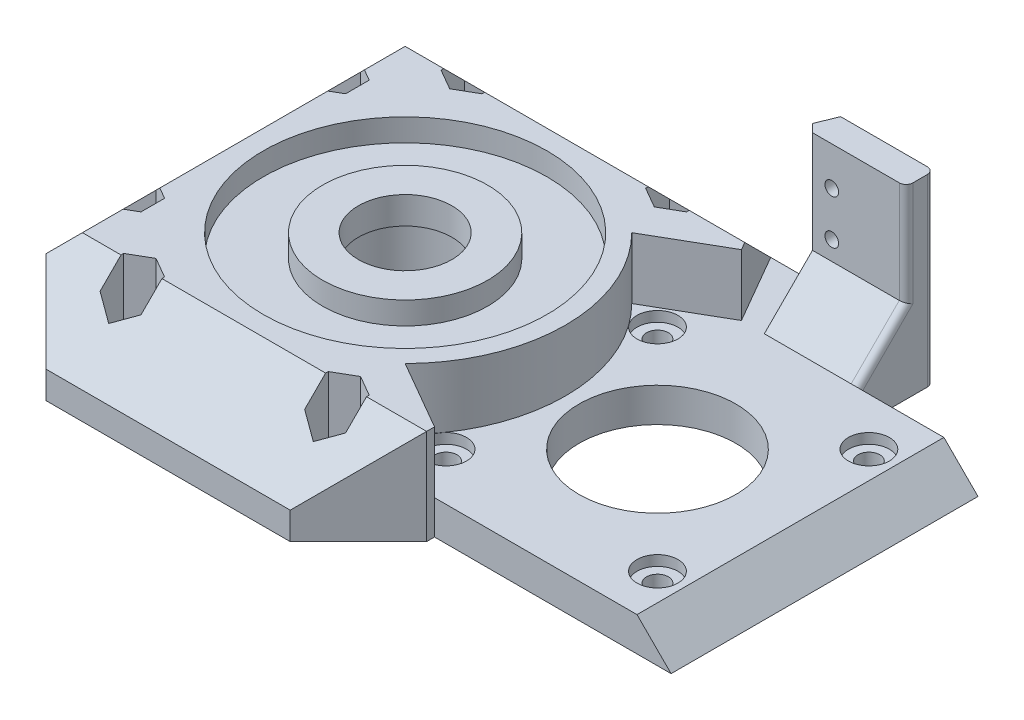
from build123d import *

# Parameters (mm, degrees)
SKETCH1_R                = 11.5
SKETCH1_R_2              = 1.6
BOSS_EXTRUDE1_DEPTH      = 5
BOSS_EXTRUDE2_DEPTH      = 9
SKETCH3_R                = 20.8
SKETCH3_R_2              = 12.1
CUT_EXTRUDE1_DEPTH       = 3.3
SKETCH4_R                = 6.85
CUT_EXTRUDE2_DEPTH       = 4
SKETCH5_R                = 7.85
CUT_EXTRUDE3_DEPTH       = 10
CUT_EXTRUDE4_DEPTH       = 10
SKETCH7_R                = 2.15
CUT_EXTRUDE5_DEPTH       = 79.90393653
CHAMFER1_SIZE            = 10
CHAMFER2_SIZE            = 14.66
CHAMFER3_SIZE            = 5
SKETCH8_R                = 3
CUT_EXTRUDE6_DEPTH       = 1.5
BOSS_EXTRUDE3_DEPTH      = 22
BOSS_EXTRUDE3_DEPTH_BACK = 1.5
BOSS_EXTRUDE4_DEPTH      = 13.73
SKETCH12_R               = 1
CUT_EXTRUDE7_DEPTH       = 13.73
SKETCH13_R               = 2.5
CUT_EXTRUDE8_DEPTH       = 1.5
FILLET1_R                = 1


# Some blends are built 0.0001 mm under size
with BuildPart() as part:
    # Sketch1 → Boss-Extrude1 (new body)
    with BuildSketch(Plane(origin=(0, 0, 0), x_dir=(1, 0, 0), z_dir=(0, 1, 0))):
        Polygon((24.5, 22.5), (24.5, -22.5), (-10.19, -22.5), (-10.19, -33.66), (-70.66, -33.66), (-70.66, 33.66), (6.9, 33.66), (6.9, 22.5), align=None)
        with Locations(Location((0, 0, 0), (0, 0, 270))):
            Circle(SKETCH1_R, mode=Mode.SUBTRACT)
        with Locations(Location((15.5, 15.5, 0), (0, 0, 270))):
            Circle(SKETCH1_R_2, mode=Mode.SUBTRACT)
        with Locations(Location((15.5, -15.5, 0), (0, 0, 270))):
            Circle(SKETCH1_R_2, mode=Mode.SUBTRACT)
        with Locations(Location((-15.5, -15.5, 0), (0, 0, 270))):
            Circle(SKETCH1_R_2, mode=Mode.SUBTRACT)
        with Locations(Location((-15.5, 15.5, 0), (0, 0, 270))):
            Circle(SKETCH1_R_2, mode=Mode.SUBTRACT)
    extrude(amount=BOSS_EXTRUDE1_DEPTH)

    # Sketch2 → Boss-Extrude2 (add)
    with BuildSketch(Plane(origin=(0, 5, 0), x_dir=(1, 0, 0), z_dir=(0, 1, 0))):
        with BuildLine():
            Line((-10.19, -33.66), (-10.19, -22.5))
            Line((-10.19, -22.5), (-20.381763801, -16.615782426))
            ThreePointArc((-20.381763801, -16.615782426), (-45.992259152, -21.711500992), (-60.5, 0))
            Line((-60.5, 0), (-70.66, 0))
            Line((-70.66, 0), (-70.66, -33.66))
            Line((-70.66, -33.66), (-10.19, -33.66))
        make_face()
        with BuildLine():
            ThreePointArc((-60.5, 0), (-45.992259152, -21.711500992), (-20.381763801, -16.615782426))
            ThreePointArc((-20.381763801, -16.615782426), (-15.288499008, -8.992259152), (-13.5, 0))
            Line((-13.5, 0), (-60.5, 0))
        make_face()
        with BuildLine():
            Line((-60.5, 0), (-13.5, 0))
            ThreePointArc((-13.5, 0), (-15.288499008, 8.992259152), (-20.381763801, 16.615782426))
            ThreePointArc((-20.381763801, 16.615782426), (-45.992259152, 21.711500992), (-60.5, 0))
        make_face()
        with BuildLine():
            Line((-70.66, 0), (-60.5, 0))
            ThreePointArc((-60.5, 0), (-45.992259152, 21.711500992), (-20.381763801, 16.615782426))
            Line((-20.381763801, 16.615782426), (-10.19, 22.5))
            Line((-10.19, 22.5), (-16.633229004, 33.66))
            Line((-16.633229004, 33.66), (-70.66, 33.66))
            Line((-70.66, 33.66), (-70.66, 0))
        make_face()
    extrude(amount=BOSS_EXTRUDE2_DEPTH)

    # Sketch3 → Cut-Extrude1 (cut)
    with BuildSketch(Plane(origin=(0, 14, 0), x_dir=(1, 0, 0), z_dir=(0, 1, 0))):
        with Locations(Location((-37, 0, 0), (0, 0, 270))):
            Circle(SKETCH3_R)
        with Locations(Location((-37, 0, 0), (0, 0, 270))):
            Circle(SKETCH3_R_2, mode=Mode.SUBTRACT)
    extrude(amount=-CUT_EXTRUDE1_DEPTH, mode=Mode.SUBTRACT)

    # Sketch4 → Cut-Extrude2 (cut)
    with BuildSketch(Plane(origin=(0, 14, 0), x_dir=(1, 0, 0), z_dir=(0, 1, 0))):
        with Locations(Location((-37, 0, 0), (0, 0, 270))):
            Circle(SKETCH4_R)
    extrude(amount=-CUT_EXTRUDE2_DEPTH, mode=Mode.SUBTRACT)

    # Sketch5 → Cut-Extrude3 (cut)
    with BuildSketch(Plane.XZ):
        with Locations(Location((-37, 0, 0), (0, 0, 270))):
            Circle(SKETCH5_R)
    extrude(amount=-CUT_EXTRUDE3_DEPTH, mode=Mode.SUBTRACT)

    # Sketch6 → Cut-Extrude4 (cut)
    with BuildSketch(Plane(origin=(0, 14, 0), x_dir=(1, 0, 0), z_dir=(0, 1, 0))):
        Polygon((-55, 26.732050808), (-52, 28.464101615), (-49, 26.732050808), (-49, 23.267949192), (-52, 21.535898385), (-55, 23.267949192), align=None)
        Polygon((-22, 28.464101615), (-25, 26.732050808), (-25, 23.267949192), (-22, 21.535898385), (-19, 23.267949192), (-19, 26.732050808), align=None)
        Polygon((-52, -21.535898385), (-55, -23.267949192), (-55, -26.732050808), (-52, -28.464101615), (-49, -26.732050808), (-49, -23.267949192), align=None)
        Polygon((-19, -26.732050808), (-22, -28.464101615), (-25, -26.732050808), (-25, -23.267949192), (-22, -21.535898385), (-19, -23.267949192), align=None)
        Polygon((-65, -13.267949192), (-62, -11.535898385), (-59, -13.267949192), (-59, -16.732050808), (-62, -18.464101615), (-65, -16.732050808), align=None)
        Polygon((-62, 11.535898385), (-59, 13.267949192), (-59, 16.732050808), (-62, 18.464101615), (-65, 16.732050808), (-65, 13.267949192), align=None)
    extrude(amount=-CUT_EXTRUDE4_DEPTH, mode=Mode.SUBTRACT)

    # Sketch7 → Cut-Extrude5 (cut, through all)
    with BuildSketch(Plane(origin=(0, 4, 0), x_dir=(1, 0, 0), z_dir=(0, 1, 0))):
        with Locations(Location((-62, -15, 0), (0, 0, 270))):
            Circle(SKETCH7_R)
        with Locations(Location((-52, -25, 0), (0, 0, 270))):
            Circle(SKETCH7_R)
        with Locations(Location((-22, -25, 0), (0, 0, 270))):
            Circle(SKETCH7_R)
        with Locations(Location((-62, 15, 0), (0, 0, 270))):
            Circle(SKETCH7_R)
        with Locations(Location((-52, 25, 0), (0, 0, 270))):
            Circle(SKETCH7_R)
        with Locations(Location((-22, 25, 0), (0, 0, 270))):
            Circle(SKETCH7_R)
    extrude(amount=-CUT_EXTRUDE5_DEPTH, mode=Mode.SUBTRACT)

    # Chamfer1
    # the kernel refuses this chamfer: 10 mm, written as the material it takes off along each edge
    with BuildSketch(Plane(origin=(-10.19, 39.71682988, 33.66), x_dir=(0.027495876610586317, 0, -0.9996219169112968), z_dir=(0, -1, 0))) as chamfer1_piece_1:
        Polygon((CHAMFER1_SIZE * 0.999621916911, -CHAMFER1_SIZE * 0.0274958766106), (-CHAMFER1_SIZE * 0.0274958766106, -CHAMFER1_SIZE * 0.999621916911), (0, 0), align=None)
    extrude(amount=65.433659759, mode=Mode.SUBTRACT)
    with BuildSketch(Plane(origin=(9.083600876, 14, -33.66), x_dir=(0, -0.9996219169112968, -0.027495876610586317), z_dir=(-1, 0, 0))) as chamfer1_piece_2:
        Polygon((CHAMFER1_SIZE * 0.999621916911, CHAMFER1_SIZE * 0.0274958766106), (-CHAMFER1_SIZE * 0.0274958766106, CHAMFER1_SIZE * 0.999621916911), (0, 0), align=None)
    extrude(amount=105.460430755, mode=Mode.SUBTRACT)
    with BuildSketch(Plane(origin=(-96.37682988, 14, 33.66), x_dir=(0, -0.9996219169112968, 0.027495876610586317), z_dir=(1, 0, 0))) as chamfer1_piece_3:
        Polygon((CHAMFER1_SIZE * 0.999621916911, CHAMFER1_SIZE * 0.0274958766106), (-CHAMFER1_SIZE * 0.0274958766106, CHAMFER1_SIZE * 0.999621916911), (0, 0), align=None)
    extrude(amount=111.903659759, mode=Mode.SUBTRACT)
    with BuildSketch(Plane(origin=(-70.66, 14, -59.37682988), x_dir=(-0.027495876610586317, -0.9996219169112968, 0), z_dir=(0, 0, 1))) as chamfer1_piece_4:
        Polygon((CHAMFER1_SIZE * 0.999621916911, CHAMFER1_SIZE * 0.0274958766106), (-CHAMFER1_SIZE * 0.0274958766106, CHAMFER1_SIZE * 0.999621916911), (0, 0), align=None)
    extrude(amount=118.753659759, mode=Mode.SUBTRACT)

    # Chamfer2
    chamfer2_edges = [part.edges().sort_by_distance(p)[0] for p in [
        (-70.66, 2, 33.66),
        (-70.66, 2, -33.66),
    ]]
    chamfer(chamfer2_edges, length=CHAMFER2_SIZE)

    # Chamfer3
    chamfer3_edges = [part.edges().sort_by_distance(p)[0] for p in [
        (24.5, 5, 0),
    ]]
    chamfer(chamfer3_edges, length=CHAMFER3_SIZE - 0.0001)  # a hair under: the kernel refuses the full size

    # Sketch8 → Cut-Extrude6 (cut)
    with BuildSketch(Plane(origin=(0, 5, 0), x_dir=(1, 0, 0), z_dir=(0, 1, 0))):
        with Locations(Location((15.5, 15.5, 0), (0, 0, 270))):
            Circle(SKETCH8_R)
        with Locations(Location((-15.5, 15.5, 0), (0, 0, 270))):
            Circle(SKETCH8_R)
        with Locations(Location((-15.5, -15.5, 0), (0, 0, 270))):
            Circle(SKETCH8_R)
        with Locations(Location((15.5, -15.5, 0), (0, 0, 270))):
            Circle(SKETCH8_R)
    extrude(amount=-CUT_EXTRUDE6_DEPTH, mode=Mode.SUBTRACT)

    # Sketch9 → Boss-Extrude3 (add, two sides: drawn at the far end of the back side and taken through both)
    with BuildSketch(Plane(origin=(0, 5, 0), x_dir=(1, 0, 0), z_dir=(0, 1, 0)).offset(-BOSS_EXTRUDE3_DEPTH_BACK)):
        Polygon((6.9, 33.66), (6.9, 29.56), (-6.8, 29.56), (-7.995869238, 30.755869238), (-6.8, 33.66), align=None)
    extrude(amount=BOSS_EXTRUDE3_DEPTH + BOSS_EXTRUDE3_DEPTH_BACK)

    # Sketch10 → Boss-Extrude4 (add)
    with BuildSketch(Plane(origin=(6.9, 0, 0), x_dir=(0, 0, -1), z_dir=(1, 0, 0))):
        Polygon((22.5, 5), (29.56, 12.06), (29.56, 5), align=None)
    extrude(amount=-BOSS_EXTRUDE4_DEPTH)

    # Sketch12 → Cut-Extrude7 (cut)
    with BuildSketch(Plane.XY.offset(-29.56)):
        with Locations((-4, 21.35)):
            Circle(SKETCH12_R)
        with Locations((-4, 14.85)):
            Circle(SKETCH12_R)
    extrude(amount=-CUT_EXTRUDE7_DEPTH, mode=Mode.SUBTRACT)

    # Sketch13 → Cut-Extrude8 (cut)
    with BuildSketch(Plane(origin=(0, 0, -33.66), x_dir=(-1, 0, 0), z_dir=(0, 0, -1))):
        with Locations((4, 14.85)):
            Circle(SKETCH13_R)
        with Locations((4, 21.35)):
            Circle(SKETCH13_R)
    extrude(amount=-CUT_EXTRUDE8_DEPTH, mode=Mode.SUBTRACT)

    # Fillet1
    fillet1_edges = [part.edges().sort_by_distance(p)[0] for p in [
        (6.9, 13.5, -33.66),
        (6.9, 19.53, -29.56),
        (6.9, 8.53, -26.03),
    ]]
    fillet(fillet1_edges, radius=FILLET1_R)


solid = part.part
